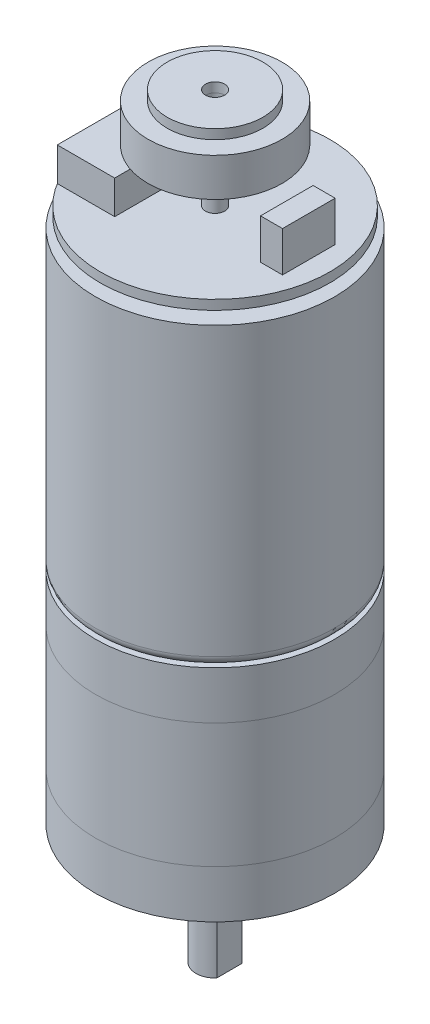
from build123d import *

# Parameters (mm, degrees)
SKETCH1_R            = 12.5
SKETCH1_R_2          = 1.5
BOSS_EXTRUDE1_DEPTH  = 5
SKETCH2_R            = 12.5
BOSS_EXTRUDE2_DEPTH  = 13
SKETCH3_R            = 12.5
BOSS_EXTRUDE3_DEPTH  = 5
SKETCH4_R            = 12.5
BOSS_EXTRUDE4_DEPTH  = 31
FILLET2_R            = 1
SKETCH5_R            = 2.5
BOSS_EXTRUDE5_DEPTH  = 1
SKETCH6_R            = 12
BOSS_EXTRUDE6_DEPTH  = 1
SKETCH7_R            = 1
BOSS_EXTRUDE7_DEPTH  = 5
SKETCH8_R            = 4
BOSS_EXTRUDE8_DEPTH  = 0.5
SKETCH9_R            = 7
BOSS_EXTRUDE9_DEPTH  = 4
SKETCH10_R           = 5
BOSS_EXTRUDE10_DEPTH = 1
SKETCH11_R           = 1
CUT_EXTRUDE1_DEPTH   = 2
SKETCH12_R           = 3.5
BOSS_EXTRUDE11_DEPTH = 2.5
SKETCH13_R           = 2
BOSS_EXTRUDE12_DEPTH = 10
CUT_EXTRUDE2_DEPTH   = 7.8
SKETCH15_W           = 6
SKETCH15_H           = 12.5
BOSS_EXTRUDE13_DEPTH = 3.5
SKETCH16_W           = 2.3
SKETCH16_H           = 5.5
BOSS_EXTRUDE14_DEPTH = 4.2


with BuildPart() as part:
    # Sketch1 → Boss-Extrude1 (new body)
    with BuildSketch(Plane(origin=(0, 0, 0), x_dir=(1, 0, 0), z_dir=(0, 1, 0))):
        with Locations(Location((0, 0, 0), (0, 0, 270))):
            Circle(SKETCH1_R)
        with Locations(Location((-8.5, 0, 0), (0, 0, 270))):
            Circle(SKETCH1_R_2, mode=Mode.SUBTRACT)
        with Locations(Location((8.5, 0, 0), (0, 0, 90))):
            Circle(SKETCH1_R_2, mode=Mode.SUBTRACT)
    extrude(amount=BOSS_EXTRUDE1_DEPTH)


with BuildPart() as body_2:
    # Sketch2 → Boss-Extrude2 (new body)
    with BuildSketch(Plane(origin=(0, 5, 0), x_dir=(1, 0, 0), z_dir=(0, 1, 0))):
        with Locations(Location((0, 0, 0), (0, 0, 90))):
            Circle(SKETCH2_R)
    extrude(amount=BOSS_EXTRUDE2_DEPTH)


with BuildPart() as body_3:
    # Sketch3 → Boss-Extrude3 (new body)
    with BuildSketch(Plane(origin=(0, 18, 0), x_dir=(1, 0, 0), z_dir=(0, 1, 0))):
        with Locations(Location((0, 0, 0), (0, 0, 270))):
            Circle(SKETCH3_R)
    extrude(amount=BOSS_EXTRUDE3_DEPTH)


with BuildPart() as body_4:
    # Sketch4 → Boss-Extrude4 (new body)
    with BuildSketch(Plane(origin=(0, 23, 0), x_dir=(1, 0, 0), z_dir=(0, 1, 0))):
        with Locations(Location((0, 0, 0), (0, 0, 270))):
            Circle(SKETCH4_R)
    extrude(amount=BOSS_EXTRUDE4_DEPTH)

    # Fillet2
    fillet2_edges = [body_4.edges().sort_by_distance(p)[0] for p in [
        (0, 23, -12.5),
    ]]
    fillet(fillet2_edges, radius=FILLET2_R)


with BuildPart() as body_5:
    # Sketch5 → Boss-Extrude5 (new body)
    with BuildSketch(Plane(origin=(0, 54, 0), x_dir=(1, 0, 0), z_dir=(0, 1, 0))):
        with Locations(Location((0, 0, 0), (0, 0, 270))):
            Circle(SKETCH5_R)
    extrude(amount=BOSS_EXTRUDE5_DEPTH)


with BuildPart() as body_6:
    # Sketch6 → Boss-Extrude6 (new body)
    with BuildSketch(Plane(origin=(0, 55, 0), x_dir=(1, 0, 0), z_dir=(0, 1, 0))):
        with Locations(Location((0, 0, 0), (0, 0, 270))):
            Circle(SKETCH6_R)
    extrude(amount=BOSS_EXTRUDE6_DEPTH)


with BuildPart() as body_7:
    # Sketch7 → Boss-Extrude7 (new body)
    with BuildSketch(Plane(origin=(0, 56, 0), x_dir=(1, 0, 0), z_dir=(0, 1, 0))):
        with Locations(Location((0, 0, 0), (0, 0, 270))):
            Circle(SKETCH7_R)
    extrude(amount=BOSS_EXTRUDE7_DEPTH)


with BuildPart() as body_8:
    # Sketch8 → Boss-Extrude8 (new body)
    with BuildSketch(Plane(origin=(0, 61, 0), x_dir=(1, 0, 0), z_dir=(0, 1, 0))):
        with Locations(Location((0, 0, 0), (0, 0, 270))):
            Circle(SKETCH8_R)
    extrude(amount=BOSS_EXTRUDE8_DEPTH)


with BuildPart() as body_9:
    # Sketch9 → Boss-Extrude9 (new body)
    with BuildSketch(Plane(origin=(0, 61.5, 0), x_dir=(1, 0, 0), z_dir=(0, 1, 0))):
        with Locations(Location((0, 0, 0), (0, 0, 270))):
            Circle(SKETCH9_R)
    extrude(amount=BOSS_EXTRUDE9_DEPTH)


with BuildPart() as body_10:
    # Sketch10 → Boss-Extrude10 (new body)
    with BuildSketch(Plane(origin=(0, 65.5, 0), x_dir=(1, 0, 0), z_dir=(0, 1, 0))):
        with Locations(Location((0, 0, 0), (0, 0, 270))):
            Circle(SKETCH10_R)
    extrude(amount=BOSS_EXTRUDE10_DEPTH)


with BuildPart() as cut_extrude1_tool:
    # Sketch11 → Cut-Extrude1 (new body)
    with BuildSketch(Plane(origin=(0, 66.5, 0), x_dir=(1, 0, 0), z_dir=(0, 1, 0))):
        with Locations(Location((0, 0, 0), (0, 0, 270))):
            Circle(SKETCH11_R)
    extrude(amount=-CUT_EXTRUDE1_DEPTH)


with BuildPart() as body_9_1:
    add(body_9.part)

    # Cut-Extrude1: cut by cut_extrude1_tool
    add(cut_extrude1_tool.part, mode=Mode.SUBTRACT)


with BuildPart() as body_10_1:
    add(body_10.part)

    # Cut-Extrude1: cut by cut_extrude1_tool
    add(cut_extrude1_tool.part, mode=Mode.SUBTRACT)


with BuildPart() as body_11:
    # Sketch12 → Boss-Extrude11 (new body)
    with BuildSketch(Plane.XZ):
        with Locations(Location((0, 0, 0), (0, 0, 270))):
            Circle(SKETCH12_R)
    extrude(amount=BOSS_EXTRUDE11_DEPTH)


with BuildPart() as body_12:
    # Sketch13 → Boss-Extrude12 (new body)
    with BuildSketch(Plane.XZ.offset(2.5)):
        with Locations(Location((0, 0, 0), (0, 0, 270))):
            Circle(SKETCH13_R)
    extrude(amount=BOSS_EXTRUDE12_DEPTH)

    # Sketch14 → Cut-Extrude2 (cut)
    with BuildSketch(Plane.XZ.offset(12.5)):
        with BuildLine():
            Line((1.5, 1.322875656), (1.5, -1.322875656))
            ThreePointArc((1.5, -1.322875656), (2, 0), (1.5, 1.322875656))
        make_face()
    extrude(amount=-CUT_EXTRUDE2_DEPTH, mode=Mode.SUBTRACT)


with BuildPart() as body_13:
    # Sketch15 → Boss-Extrude13 (new body)
    with BuildSketch(Plane(origin=(0, 56, 0), x_dir=(1, 0, 0), z_dir=(0, 1, 0))):
        with Locations((-7.243900624, 0)):
            Rectangle(SKETCH15_W, SKETCH15_H)
    extrude(amount=BOSS_EXTRUDE13_DEPTH)


with BuildPart() as body_14:
    # Sketch16 → Boss-Extrude14 (new body)
    with BuildSketch(Plane(origin=(0, 56, 0), x_dir=(1, 0, 0), z_dir=(0, 1, 0))):
        with Locations((8.65, 0)):
            Rectangle(SKETCH16_W, SKETCH16_H)
    extrude(amount=BOSS_EXTRUDE14_DEPTH)


solid = Compound([part.part, body_2.part, body_3.part, body_4.part, body_5.part, body_6.part, body_7.part, body_8.part, body_9_1.part, body_10_1.part, body_11.part, body_12.part, body_13.part, body_14.part])
